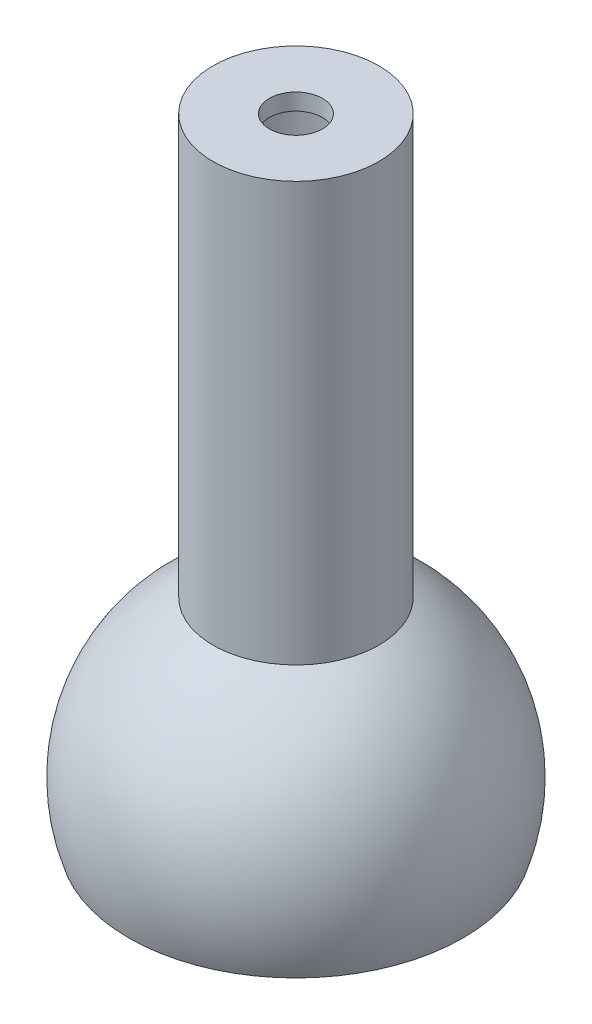
from build123d import *

# Parameters (mm, degrees)
ESBO_O1_R                = 5
RESSALTO_EXTRUS_O1_DEPTH = 30
RESSALTO_EXTRUS_O4_START = -74
ESBO_O4_R                = 5
RESSALTO_EXTRUS_O4_DEPTH = 74
ESBO_O3_R                = 71.162261847
CORTE_EXTRUS_O2_DEPTH    = 36
CORTE_EXTRUS_O3_REACH    = 42.863
ESBO_O6_R                = 1.6


# Read off the part's stored shape, not the designer's step: Domo1, Casca3
with BuildPart() as part:
    # Esboço1 → Ressalto-extrusão1 (new body)
    with BuildSketch(Plane(origin=(0, 0, 0), x_dir=(1, 0, 0), z_dir=(0, 1, 0))):
        with Locations(Location((0, 0, 0), (0, 0, 270))):
            Circle(ESBO_O1_R)
    extrude(amount=-RESSALTO_EXTRUS_O1_DEPTH)

    # Domo1 outline → Domo1 (revolve)
    with BuildSketch(Plane.XY):
        with BuildLine():
            Line((0, 0), (4.999999996, -3e-09))
            ThreePointArc((4.999999996, -3e-09), (10.307764064, 11.951941013), (0, 20))
            Line((0, 20), (0, 0))
        make_face()
    revolve(axis=Axis((0, 0, 0), (0, 1, 0)))

    # Esboço4 → Ressalto-extrusão4 (add)
    with BuildSketch(Plane.XZ.offset(30).offset(RESSALTO_EXTRUS_O4_START)):
        with Locations(Location((0, 0, 0), (0, 0, 90))):
            Circle(ESBO_O4_R)
    extrude(amount=RESSALTO_EXTRUS_O4_DEPTH)

    # Esboço3 → Corte-extrusão2 (cut)
    with BuildSketch(Plane.XZ.offset(30)):
        Circle(ESBO_O3_R)
    extrude(amount=-CORTE_EXTRUS_O2_DEPTH, mode=Mode.SUBTRACT)

    # Casca3 outline → Casca3 (revolve, cut)
    with BuildSketch(Plane.XY):
        with BuildLine():
            Line((3.999999997, 18.129463148), (4, 43))
            Line((4, 43), (0, 43))
            Line((0, 43), (0, 5.999999991))
            Line((0, 5.999999991), (9.013878185, 5.999999991))
            ThreePointArc((9.013878185, 5.999999991), (8.895011268, 13.051873609), (3.999999997, 18.129463148))
        make_face()
    revolve(axis=Axis((0, 0, 0), (0, 1, 0)), mode=Mode.SUBTRACT)

    # Esboço6 → Corte-extrusão3 (cut, up to next)
    with BuildSketch(Plane(origin=(0, 44, 0), x_dir=(1, 0, 0), z_dir=(0, 1, 0)), mode=Mode.PRIVATE) as corte_extrus_o3_sk1:
        with Locations(Location((0, 0, 0), (0, 0, 270))):
            Circle(ESBO_O6_R)
    corte_extrus_o3_tool1 = extrude(corte_extrus_o3_sk1.sketch, amount=-CORTE_EXTRUS_O3_REACH, mode=Mode.PRIVATE) & part.part
    add(corte_extrus_o3_tool1.solids().sort_by_distance((0, 44, 0))[0], mode=Mode.SUBTRACT)


solid = part.part
